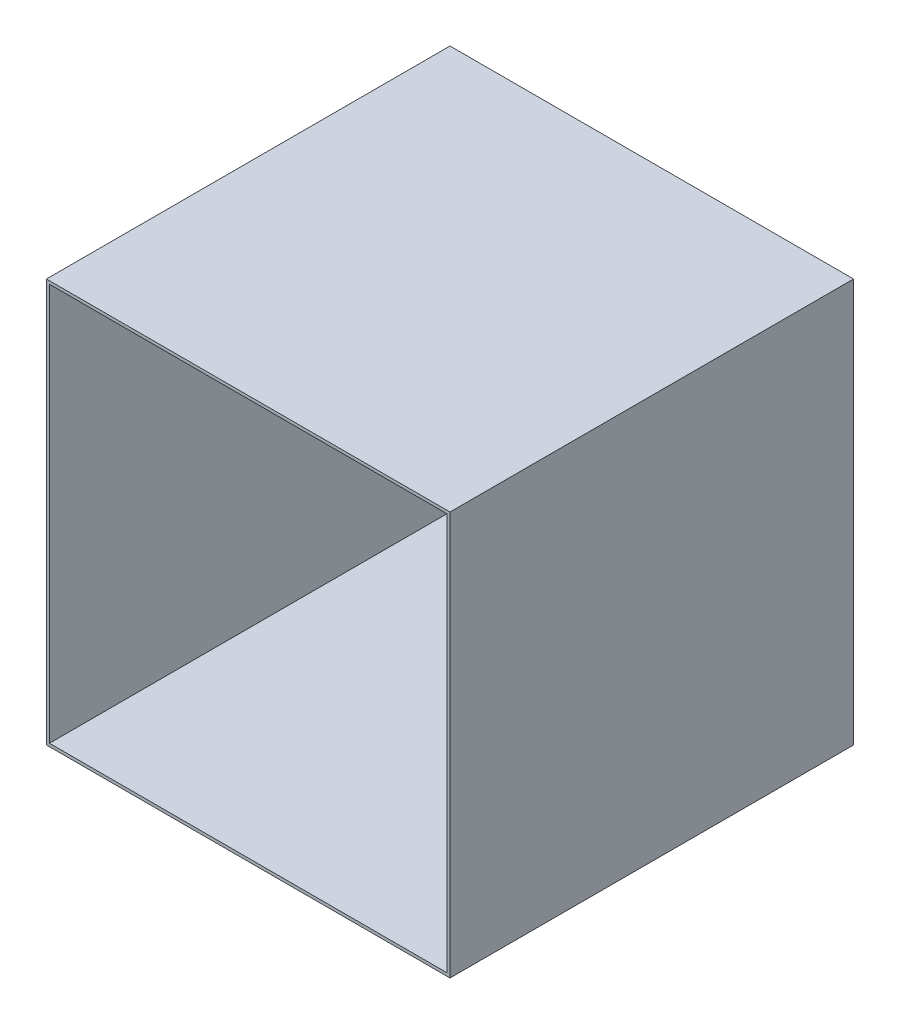
from build123d import *

# Parameters (mm, degrees)
CROQUIS1_W              = 80
CROQUIS1_H              = 80
SALIENTE_EXTRUIR1_DEPTH = 80
VACIADO1_T              = -0.6


with BuildPart() as part:
    # Croquis1 → Saliente-Extruir1 (new body)
    with BuildSketch(Plane.XY):
        with Locations((40, 40)):
            Rectangle(CROQUIS1_W, CROQUIS1_H)
    extrude(amount=SALIENTE_EXTRUIR1_DEPTH)

    # Vaciado1
    vaciado1_openings = [part.faces().sort_by_distance(p)[0] for p in [
        (40, 40, 0),
        (40, 40, 80),
    ]]
    offset(amount=VACIADO1_T, openings=vaciado1_openings, kind=Kind.INTERSECTION)


solid = part.part
